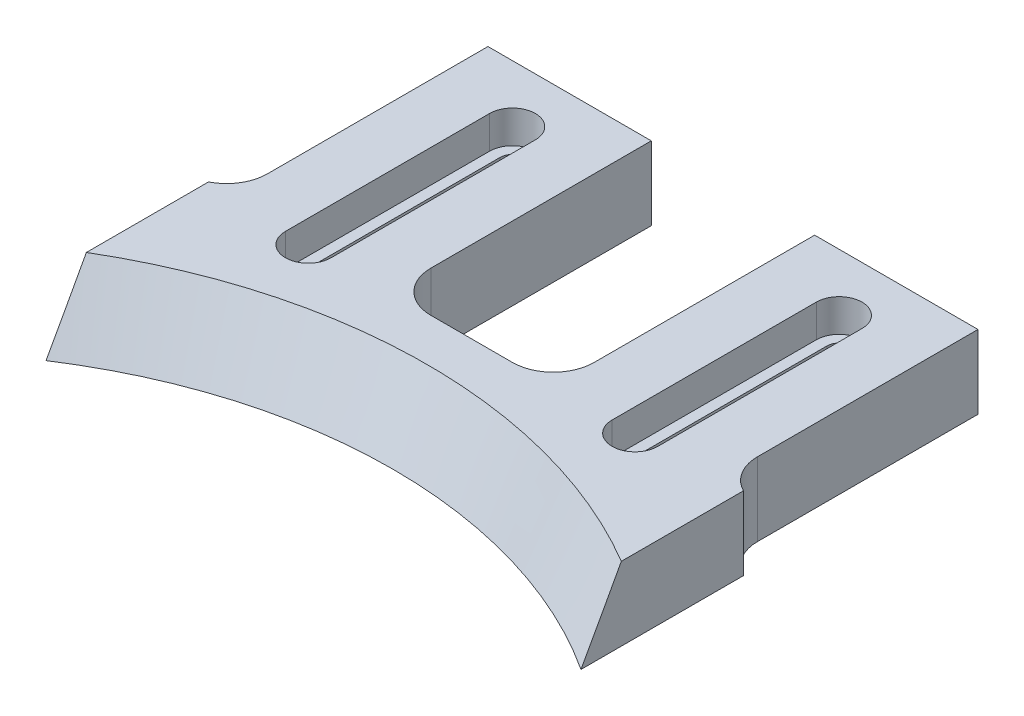
from build123d import *

# Parameters (mm, degrees)
BOSS_EXTRUDE1_DEPTH = 9
CUT_EXTRUDE2_REACH  = 95.842
SKETCH5_W           = 20
SKETCH5_H           = 32
SKETCH5_W_2         = 7.75
CUT_EXTRUDE3_DEPTH  = 10
FILLET1_R           = 5
CUT_EXTRUDE4_DEPTH  = 4
CHAMFER1_SIZE       = 9
CHAMFER1_SIZE_2     = 4.196768923
CUT_EXTRUDE5_REACH  = 95.842
SKETCH7_W           = 5
SKETCH7_H           = 33.085129134
SKETCH7_H_2         = 33.745309592


with BuildPart() as part:
    # Sketch1 → Boss-Extrude1 (new body)
    with BuildSketch(Plane(origin=(0, 0, 0), x_dir=(1, 0, 0), z_dir=(0, 1, 0))):
        with BuildLine():
            Line((0, 0), (0, 55))
            Line((0, 55), (75.5, 55))
            Line((75.5, 55), (75.5, 0))
            ThreePointArc((75.5, 0), (37.75, 13.36377481), (0, 0))
        make_face()
    extrude(amount=BOSS_EXTRUDE1_DEPTH)

    # Sketch4 → Cut-Extrude2 (cut, up to next)
    with BuildSketch(Plane(origin=(0, 9, 0), x_dir=(1, 0, 0), z_dir=(0, 1, 0)), mode=Mode.PRIVATE) as cut_extrude2_sk1:
        with BuildLine():
            Line((19.25, 48), (19.25, 23))
            ThreePointArc((19.25, 23), (17.75, 21.5), (16.25, 23))
            Line((16.25, 23), (16.25, 48))
            ThreePointArc((16.25, 48), (17.75, 49.5), (19.25, 48))
        make_face()
    cut_extrude2_tool1 = extrude(cut_extrude2_sk1.sketch, amount=-CUT_EXTRUDE2_REACH, mode=Mode.PRIVATE) & part.part
    # Sketch4 → Cut-Extrude2 (cut, up to next)
    with BuildSketch(Plane(origin=(0, 9, 0), x_dir=(1, 0, 0), z_dir=(0, 1, 0)), mode=Mode.PRIVATE) as cut_extrude2_sk2:
        with BuildLine():
            Line((59.25, 48), (59.25, 23))
            ThreePointArc((59.25, 23), (57.75, 21.5), (56.25, 23))
            Line((56.25, 23), (56.25, 48))
            ThreePointArc((56.25, 48), (57.75, 49.5), (59.25, 48))
        make_face()
    cut_extrude2_tool2 = extrude(cut_extrude2_sk2.sketch, amount=-CUT_EXTRUDE2_REACH, mode=Mode.PRIVATE) & part.part
    add(cut_extrude2_tool1.solids().sort_by_distance((17.75, 9, -35.5))[0], mode=Mode.SUBTRACT)
    add(cut_extrude2_tool2.solids().sort_by_distance((57.75, 9, -35.5))[0], mode=Mode.SUBTRACT)

    # Sketch5 → Cut-Extrude3 (cut)
    with BuildSketch(Plane(origin=(0, 9, 0), x_dir=(1, 0, 0), z_dir=(0, 1, 0))):
        with Locations((37.75, 39)):
            Rectangle(SKETCH5_W, SKETCH5_H)
        with Locations((71.625, 39)):
            Rectangle(SKETCH5_W_2, SKETCH5_H)
        with Locations((3.875, 39)):
            Rectangle(SKETCH5_W_2, SKETCH5_H)
    extrude(amount=-CUT_EXTRUDE3_DEPTH, mode=Mode.SUBTRACT)

    # Fillet1
    fillet1_edges = [part.edges().sort_by_distance(p)[0] for p in [
        (27.75, 4.5, -23),
        (47.75, 4.5, -23),
        (7.75, 4.5, -23),
        (67.75, 4.5, -23),
    ]]
    fillet(fillet1_edges, radius=FILLET1_R)

    # Sketch6 → Cut-Extrude4 (cut)
    with BuildSketch(Plane(origin=(0, 9, 0), x_dir=(1, 0, 0), z_dir=(0, 1, 0))):
        with BuildLine():
            Line((20.55, 48), (20.55, 23))
            ThreePointArc((20.55, 23), (17.75, 20.2), (14.95, 23))
            Line((14.95, 23), (14.95, 48))
            ThreePointArc((14.95, 48), (17.75, 50.8), (20.55, 48))
        make_face()
        with BuildLine():
            Line((60.55, 48), (60.55, 23))
            ThreePointArc((60.55, 23), (57.75, 20.2), (54.95, 23))
            Line((54.95, 23), (54.95, 48))
            ThreePointArc((54.95, 48), (57.75, 50.8), (60.55, 48))
        make_face()
    extrude(amount=-CUT_EXTRUDE4_DEPTH, mode=Mode.SUBTRACT)

    # Chamfer1
    # the kernel refuses this chamfer: 9, 4.196768923 mm, written as the material it takes off along each edge
    with BuildSketch(Plane(origin=(37.75, 9, 46.63622519), x_dir=(0.8768373409785211, 0, -0.4807871436152561), z_dir=(0.4807871436152561, 0, 0.8768373409785211))) as chamfer1_piece_1:
        Polygon((60, -CHAMFER1_SIZE), (60 + CHAMFER1_SIZE_2, 0), (60, 0), align=None)
    revolve(axis=Axis((37.75, 9, 46.63622519), (0, 1, 0)), revolution_arc=122.526351541, mode=Mode.SUBTRACT)

    # Sketch7 → Cut-Extrude5 (cut, up to next)
    with BuildSketch(Plane(origin=(0, 9, 0), x_dir=(1, 0, 0), z_dir=(0, 1, 0)), mode=Mode.PRIVATE) as cut_extrude5_sk1:
        with Locations((2.5, 16.542564567)):
            Rectangle(SKETCH7_W, SKETCH7_H)
    cut_extrude5_tool1 = extrude(cut_extrude5_sk1.sketch, amount=-CUT_EXTRUDE5_REACH, mode=Mode.PRIVATE) & part.part
    # Sketch7 → Cut-Extrude5 (cut, up to next)
    with BuildSketch(Plane(origin=(0, 9, 0), x_dir=(1, 0, 0), z_dir=(0, 1, 0)), mode=Mode.PRIVATE) as cut_extrude5_sk2:
        with Locations((73, 16.872654796)):
            Rectangle(SKETCH7_W, SKETCH7_H_2)
    cut_extrude5_tool2 = extrude(cut_extrude5_sk2.sketch, amount=-CUT_EXTRUDE5_REACH, mode=Mode.PRIVATE) & part.part
    add(cut_extrude5_tool1.solids().sort_by_distance((2.5, 9, -16.542565))[0], mode=Mode.SUBTRACT)
    add(cut_extrude5_tool2.solids().sort_by_distance((73, 9, -16.872655))[0], mode=Mode.SUBTRACT)


solid = part.part
